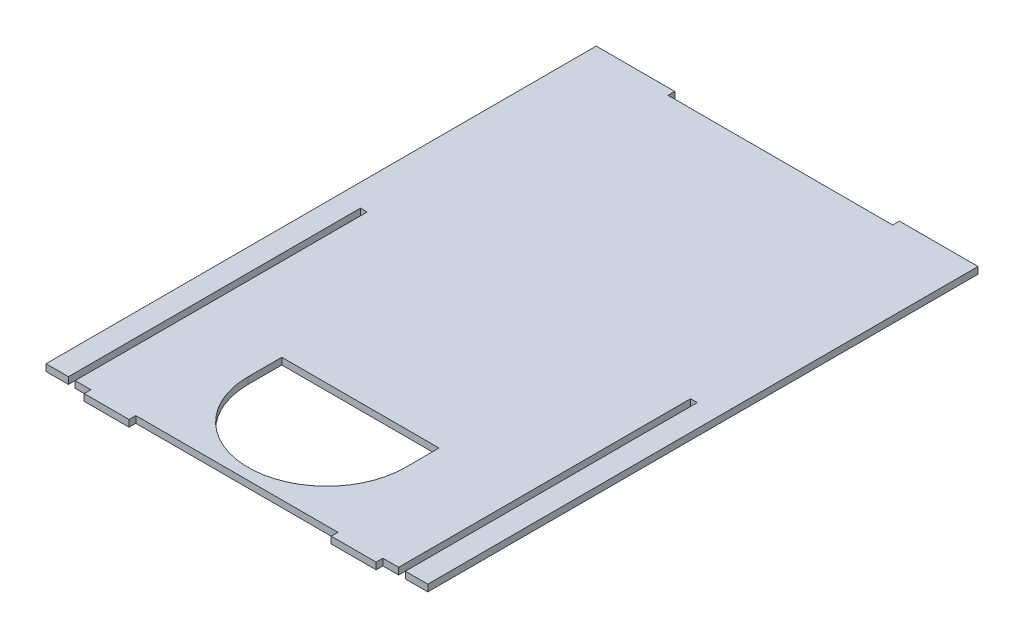
from build123d import *

# Parameters (mm, degrees)
BOSS_EXTRUDE1_DEPTH = 6
SKETCH2_W           = 6
SKETCH2_H           = 260
CUT_EXTRUDE1_DEPTH  = 6
LPATTERN1_COUNT     = 2
LPATTERN1_PITCH     = 294
SKETCH3_W           = 200
SKETCH3_H           = 6
CUT_EXTRUDE2_DEPTH  = 6


with BuildPart() as part:
    # Sketch1 → Boss-Extrude1 (new body)
    with BuildSketch(Plane(origin=(0, 0, 0), x_dir=(1, 0, 0), z_dir=(0, 1, 0))):
        Polygon((300, 0), (300, -6), (260, -6), (260, 0), (80, 0), (80, -6), (40, -6), (40, 0), (0, 0), (0, 490), (340, 490), (340, 0), align=None)
    extrude(amount=BOSS_EXTRUDE1_DEPTH)

    # Sketch2 → Cut-Extrude1 (cut)
    with BuildSketch(Plane(origin=(0, 6, 0), x_dir=(1, 0, 0), z_dir=(0, 1, 0))):
        with Locations((23, 130)):
            Rectangle(SKETCH2_W, SKETCH2_H)
    cut_extrude1 = extrude(amount=-CUT_EXTRUDE1_DEPTH, mode=Mode.SUBTRACT)

    # LPattern1: Cut-Extrude1 ×2
    with Locations(*[(i * LPATTERN1_PITCH, 0, 0) for i in range(1, LPATTERN1_COUNT)]):
        add(cut_extrude1, mode=Mode.SUBTRACT)

    # Sketch3 → Cut-Extrude2 (cut)
    with BuildSketch(Plane(origin=(0, 6, 0), x_dir=(1, 0, 0), z_dir=(0, 1, 0))):
        with BuildLine():
            Line((100, 80), (100, 110))
            Line((100, 110), (240, 110))
            Line((240, 110), (240, 80))
            ThreePointArc((240, 80), (170, 10), (100, 80))
        make_face()
        with Locations((170, 487)):
            Rectangle(SKETCH3_W, SKETCH3_H)
    extrude(amount=-CUT_EXTRUDE2_DEPTH, mode=Mode.SUBTRACT)


solid = part.part
